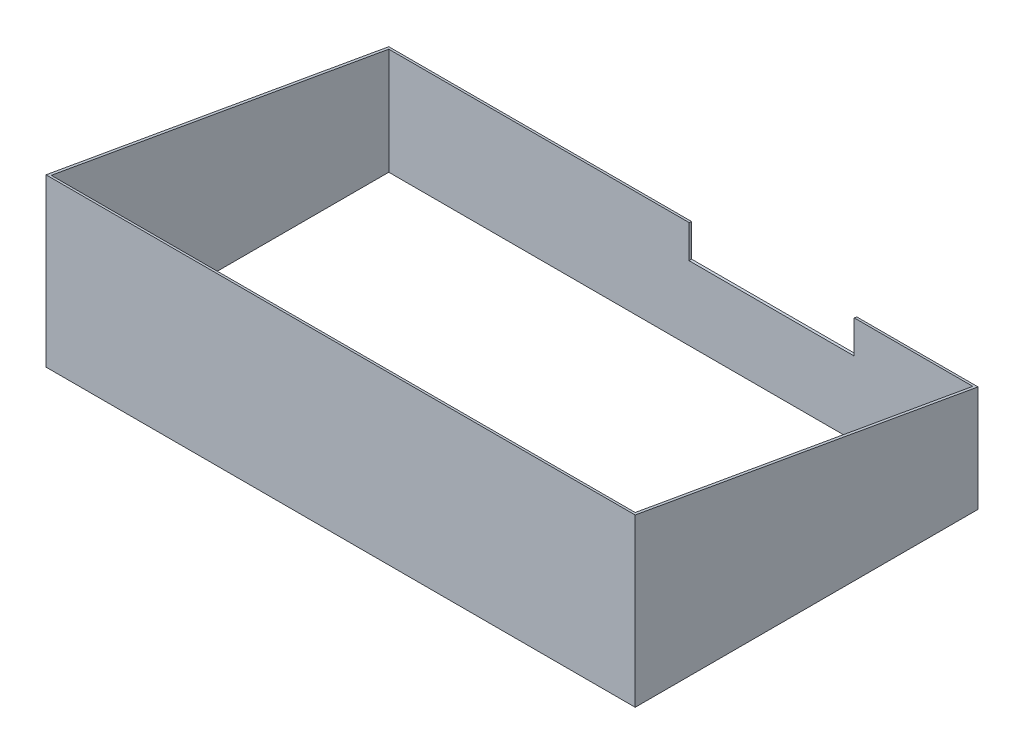
from build123d import *

# Parameters (mm, degrees)
BOSS_EXTRUDE1_DEPTH      = 713.5
BOSS_EXTRUDE1_DEPTH_BACK = 713.5
SHELL1_T                 = -6.35
CUT_EXTRUDE2_REACH       = 1164.118
SKETCH3_W                = 400
SKETCH3_H                = 90
CUT_EXTRUDE3_REACH       = 1701.491
SKETCH4_W                = 93
SKETCH4_H                = 102


with BuildPart() as part:
    # Sketch1 → Boss-Extrude1 (new, two sides: drawn at the far end of the back side and taken through both)
    with BuildSketch(Plane(origin=(0, 0, 0), x_dir=(0, 0, -1), z_dir=(1, 0, 0)).offset(-BOSS_EXTRUDE1_DEPTH_BACK)):
        Polygon((0, 403.385413773), (0, 0), (830.192935789, 0), (830.192935789, 257), align=None)
    extrude(amount=BOSS_EXTRUDE1_DEPTH + BOSS_EXTRUDE1_DEPTH_BACK)

    # Shell1
    shell1_openings = [part.faces().sort_by_distance(p)[0] for p in [
        (0, 0, -415.096467895),
        (0, 330.192706887, -415.096467895),
    ]]
    offset(amount=SHELL1_T, openings=shell1_openings, kind=Kind.INTERSECTION)

    # Sketch3 → Cut-Extrude2 (cut, up to next)
    with BuildSketch(Plane.XY.offset(-823.842935789), mode=Mode.PRIVATE) as cut_extrude2_sk1:
        with Locations((220, 223.119676327)):
            Rectangle(SKETCH3_W, SKETCH3_H)
    cut_extrude2_tool1 = extrude(cut_extrude2_sk1.sketch, amount=-CUT_EXTRUDE2_REACH, mode=Mode.PRIVATE) & part.part
    add(cut_extrude2_tool1.solids().sort_by_distance((220, 223.119676, -823.842936))[0], mode=Mode.SUBTRACT)

    # Sketch4 → Cut-Extrude3 (cut, up to next)
    with BuildSketch(Plane.ZY.offset(713.5), mode=Mode.PRIVATE) as cut_extrude3_sk1:
        with Locations((-205, 83)):
            Rectangle(SKETCH4_W, SKETCH4_H)
    cut_extrude3_tool1 = extrude(cut_extrude3_sk1.sketch, amount=-CUT_EXTRUDE3_REACH, mode=Mode.PRIVATE) & part.part
    add(cut_extrude3_tool1.solids().sort_by_distance((-713.5, 83, -205))[0], mode=Mode.SUBTRACT)


solid = part.part
